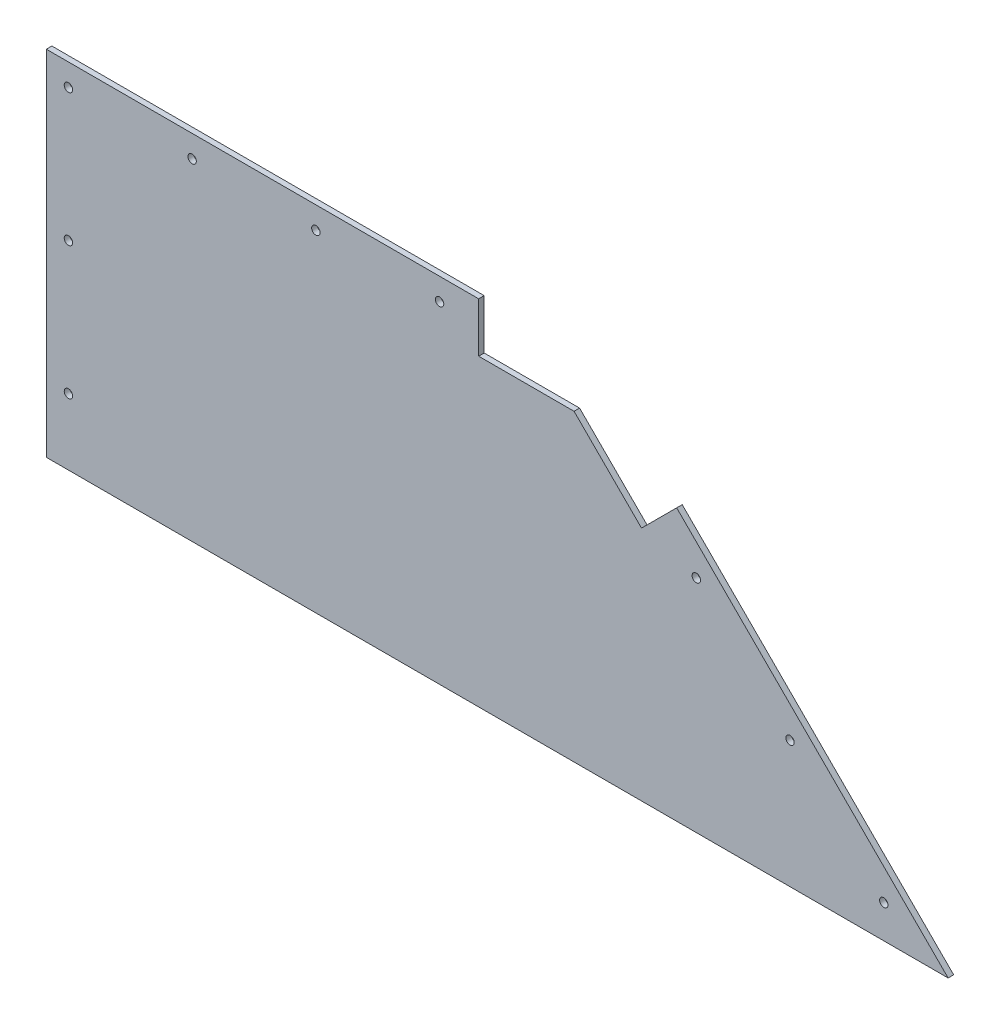
from build123d import *

# Parameters (mm, degrees)
BOSS_EXTRUDE1_DEPTH = 3.175
CUT_EXTRUDE1_REACH  = 558.824
SKETCH2_R           = 2.413
CUT_EXTRUDE2_REACH  = 558.824
SKETCH3_R           = 2.413
CUT_EXTRUDE3_REACH  = 558.824


with BuildPart() as part:
    # Sketch1 → Boss-Extrude1 (new body)
    with BuildSketch(Plane.XY):
        Polygon((315.214, 203.2), (518.414, 0), (127, 0), (0, 0), (0, 203.2), align=None)
    extrude(amount=BOSS_EXTRUDE1_DEPTH)

    # Sketch2 → Cut-Extrude1 (cut, up to next)
    with BuildSketch(Plane.XY.offset(3.175), mode=Mode.PRIVATE) as cut_extrude1_sk1:
        with Locations((12.7, 190.5)):
            Circle(SKETCH2_R)
    cut_extrude1_tool1 = extrude(cut_extrude1_sk1.sketch, amount=-CUT_EXTRUDE1_REACH, mode=Mode.PRIVATE) & part.part
    # Sketch2 → Cut-Extrude1 (cut, up to next)
    with BuildSketch(Plane.XY.offset(3.175), mode=Mode.PRIVATE) as cut_extrude1_sk2:
        with Locations((83.82, 190.5)):
            Circle(SKETCH2_R)
    cut_extrude1_tool2 = extrude(cut_extrude1_sk2.sketch, amount=-CUT_EXTRUDE1_REACH, mode=Mode.PRIVATE) & part.part
    # Sketch2 → Cut-Extrude1 (cut, up to next)
    with BuildSketch(Plane.XY.offset(3.175), mode=Mode.PRIVATE) as cut_extrude1_sk3:
        with Locations((154.94, 190.5)):
            Circle(SKETCH2_R)
    cut_extrude1_tool3 = extrude(cut_extrude1_sk3.sketch, amount=-CUT_EXTRUDE1_REACH, mode=Mode.PRIVATE) & part.part
    # Sketch2 → Cut-Extrude1 (cut, up to next)
    with BuildSketch(Plane.XY.offset(3.175), mode=Mode.PRIVATE) as cut_extrude1_sk4:
        with Locations((226.06, 190.5)):
            Circle(SKETCH2_R)
    cut_extrude1_tool4 = extrude(cut_extrude1_sk4.sketch, amount=-CUT_EXTRUDE1_REACH, mode=Mode.PRIVATE) & part.part
    # Sketch2 → Cut-Extrude1 (cut, up to next)
    with BuildSketch(Plane.XY.offset(3.175), mode=Mode.PRIVATE) as cut_extrude1_sk5:
        with Locations((12.7, 114.3)):
            Circle(SKETCH2_R)
    cut_extrude1_tool5 = extrude(cut_extrude1_sk5.sketch, amount=-CUT_EXTRUDE1_REACH, mode=Mode.PRIVATE) & part.part
    # Sketch2 → Cut-Extrude1 (cut, up to next)
    with BuildSketch(Plane.XY.offset(3.175), mode=Mode.PRIVATE) as cut_extrude1_sk6:
        with Locations((12.7, 38.1)):
            Circle(SKETCH2_R)
    cut_extrude1_tool6 = extrude(cut_extrude1_sk6.sketch, amount=-CUT_EXTRUDE1_REACH, mode=Mode.PRIVATE) & part.part
    add(cut_extrude1_tool1.solids().sort_by_distance((12.7, 190.5, 3.175))[0], mode=Mode.SUBTRACT)
    add(cut_extrude1_tool2.solids().sort_by_distance((83.82, 190.5, 3.175))[0], mode=Mode.SUBTRACT)
    add(cut_extrude1_tool3.solids().sort_by_distance((154.94, 190.5, 3.175))[0], mode=Mode.SUBTRACT)
    add(cut_extrude1_tool4.solids().sort_by_distance((226.06, 190.5, 3.175))[0], mode=Mode.SUBTRACT)
    add(cut_extrude1_tool5.solids().sort_by_distance((12.7, 114.3, 3.175))[0], mode=Mode.SUBTRACT)
    add(cut_extrude1_tool6.solids().sort_by_distance((12.7, 38.1, 3.175))[0], mode=Mode.SUBTRACT)

    # Sketch3 → Cut-Extrude2 (cut, up to next)
    with BuildSketch(Plane.XY.offset(3.175), mode=Mode.PRIVATE) as cut_extrude2_sk1:
        with Locations((481.403487758, 19.05)):
            Circle(SKETCH3_R)
    cut_extrude2_tool1 = extrude(cut_extrude2_sk1.sketch, amount=-CUT_EXTRUDE2_REACH, mode=Mode.PRIVATE) & part.part
    # Sketch3 → Cut-Extrude2 (cut, up to next)
    with BuildSketch(Plane.XY.offset(3.175), mode=Mode.PRIVATE) as cut_extrude2_sk2:
        with Locations((427.521951031, 72.931536726)):
            Circle(SKETCH3_R)
    cut_extrude2_tool2 = extrude(cut_extrude2_sk2.sketch, amount=-CUT_EXTRUDE2_REACH, mode=Mode.PRIVATE) & part.part
    # Sketch3 → Cut-Extrude2 (cut, up to next)
    with BuildSketch(Plane.XY.offset(3.175), mode=Mode.PRIVATE) as cut_extrude2_sk3:
        with Locations((373.640414305, 126.813073453)):
            Circle(SKETCH3_R)
    cut_extrude2_tool3 = extrude(cut_extrude2_sk3.sketch, amount=-CUT_EXTRUDE2_REACH, mode=Mode.PRIVATE) & part.part
    # Sketch3 → Cut-Extrude2 (cut, up to next)
    with BuildSketch(Plane.XY.offset(3.175), mode=Mode.PRIVATE) as cut_extrude2_sk4:
        with Locations((319.758877579, 180.694610179)):
            Circle(SKETCH3_R)
    cut_extrude2_tool4 = extrude(cut_extrude2_sk4.sketch, amount=-CUT_EXTRUDE2_REACH, mode=Mode.PRIVATE) & part.part
    add(cut_extrude2_tool1.solids().sort_by_distance((481.403488, 19.05, 3.175))[0], mode=Mode.SUBTRACT)
    add(cut_extrude2_tool2.solids().sort_by_distance((427.521951, 72.931537, 3.175))[0], mode=Mode.SUBTRACT)
    add(cut_extrude2_tool3.solids().sort_by_distance((373.640414, 126.813073, 3.175))[0], mode=Mode.SUBTRACT)
    add(cut_extrude2_tool4.solids().sort_by_distance((319.758878, 180.69461, 3.175))[0], mode=Mode.SUBTRACT)

    # Sketch4 → Cut-Extrude3 (cut, up to next)
    with BuildSketch(Plane.XY.offset(3.175), mode=Mode.PRIVATE) as cut_extrude3_sk1:
        Polygon((315.214, 203.2), (248.539, 203.2), (248.539, 174.625), (303.377847455, 174.625), (342.154768363, 135.848079092), (362.360344636, 156.053655364), align=None)
    cut_extrude3_tool1 = extrude(cut_extrude3_sk1.sketch, amount=-CUT_EXTRUDE3_REACH, mode=Mode.PRIVATE) & part.part
    add(cut_extrude3_tool1.solids().sort_by_distance((305.025183, 178.602019, 3.175))[0], mode=Mode.SUBTRACT)


solid = part.part
